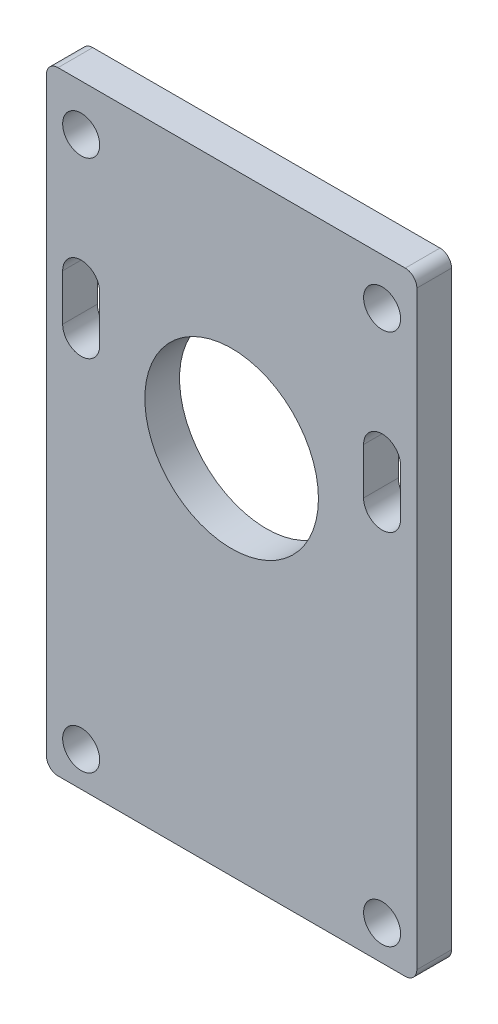
from build123d import *

# Parameters (mm, degrees)
SKETCH1_W            = 32
SKETCH1_H            = 53
BOSS_EXTRUDE1_DEPTH  = 3
M3_CLEARANCE_HOLE1_D = 3.2
FILLET1_R            = 1
SKETCH5_R            = 7.5
CUT_EXTRUDE1_DEPTH   = 62.983868869
CUT_EXTRUDE5_DEPTH   = 60


with BuildPart() as part:
    # Sketch1 → Boss-Extrude1 (new body)
    with BuildSketch(Plane.XY):
        with Locations((16, 26.5)):
            Rectangle(SKETCH1_W, SKETCH1_H)
    extrude(amount=BOSS_EXTRUDE1_DEPTH)

    # M3 Clearance Hole1 (through all)
    with Locations(Plane.XY.offset(3)):
        with Locations((3, 49), (3, 3), (29, 49), (29, 3)):
            Hole(M3_CLEARANCE_HOLE1_D / 2)

    # Fillet1
    fillet1_edges = [part.edges().sort_by_distance(p)[0] for p in [
        (32, 0, 1.5),
        (32, 53, 1.5),
        (0, 0, 1.5),
        (0, 53, 1.5),
    ]]
    fillet(fillet1_edges, radius=FILLET1_R)

    # Sketch5 → Cut-Extrude1 (cut, through all)
    with BuildSketch(Plane.XY.offset(3)):
        with Locations((16, 32)):
            Circle(SKETCH5_R)
    extrude(amount=-CUT_EXTRUDE1_DEPTH, mode=Mode.SUBTRACT)

    # Sketch11 → Cut-Extrude5 (cut)
    with BuildSketch(Plane.XY.offset(3)):
        with BuildLine():
            Line((4.6, 38), (4.6, 34))
            ThreePointArc((4.6, 34), (3, 32.4), (1.4, 34))
            Line((1.4, 34), (1.4, 38))
            ThreePointArc((1.4, 38), (3, 39.6), (4.6, 38))
        make_face()
        with BuildLine():
            Line((27.4, 38), (27.4, 34))
            ThreePointArc((27.4, 34), (29, 32.4), (30.6, 34))
            Line((30.6, 34), (30.6, 38))
            ThreePointArc((30.6, 38), (29, 39.6), (27.4, 38))
        make_face()
    extrude(amount=-CUT_EXTRUDE5_DEPTH, mode=Mode.SUBTRACT)


solid = part.part
